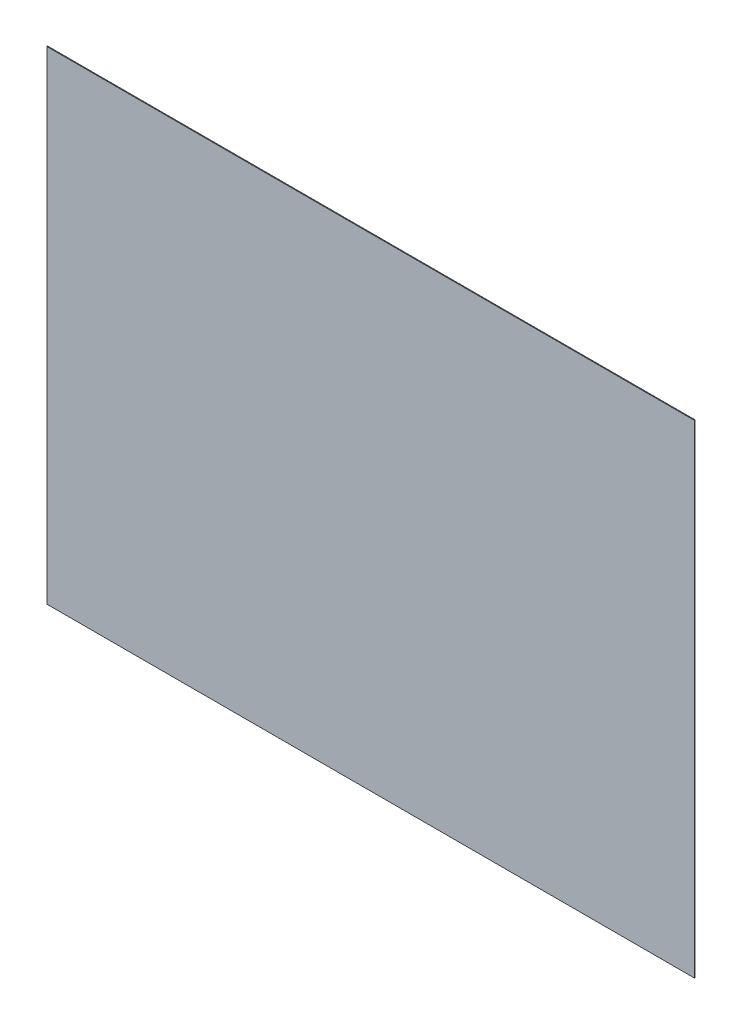
from build123d import *

# Parameters (mm, degrees)
SKETCH2_W          = 12000
SKETCH2_H          = 8950
BASE_FLANGE1_DEPTH = 15


# Sheet-metal steps are written as plain solids
with BuildPart() as part:
    # Sketch2 → Base-Flange1 (new body)
    with BuildSketch(Plane.XY):
        with Locations((6000, 4475)):
            Rectangle(SKETCH2_W, SKETCH2_H)
    extrude(amount=BASE_FLANGE1_DEPTH)


solid = part.part
